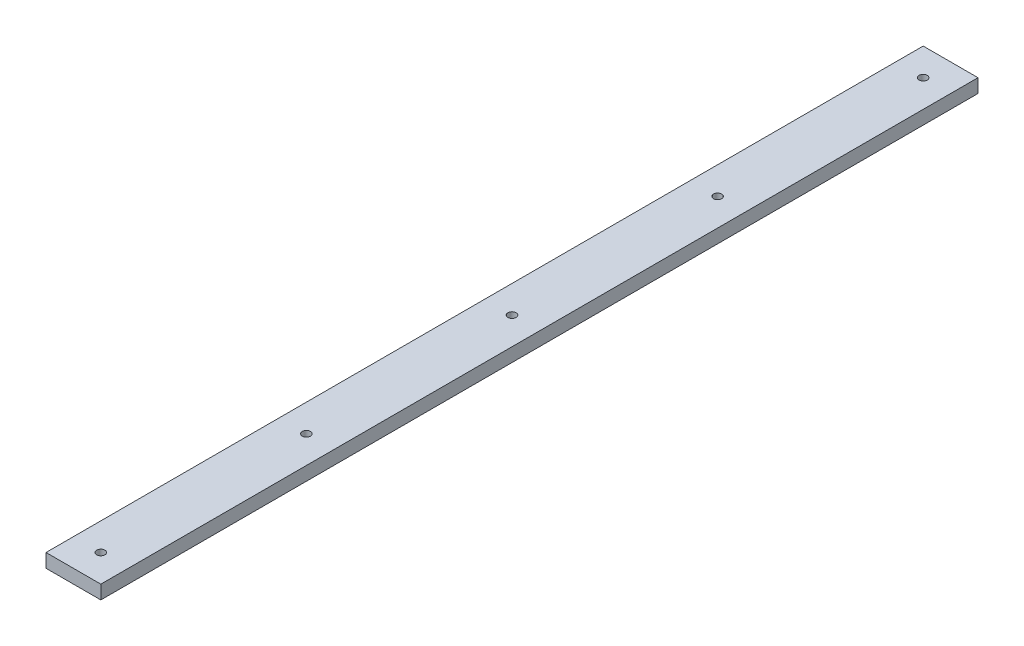
from build123d import *

# Parameters (mm, degrees)
SKETCH_1_W             = 40
SKETCH_1_H             = 640
EXTRUDE_1_DEPTH        = 5
SKETCH_2_R             = 3
CUT_EXTRUDE_1_DEPTH    = 321.780298647
PATTERN_LINEAR_1_COUNT = 5
PATTERN_LINEAR_1_PITCH = 150


with BuildPart() as part:
    # Эскиз1 → Бобышка-Вытянуть1 (new, symmetric)
    with BuildSketch(Plane(origin=(0, 0, 0), x_dir=(1, 0, 0), z_dir=(0, 1, 0))):
        Rectangle(SKETCH_1_W, SKETCH_1_H)
    extrude(amount=EXTRUDE_1_DEPTH, both=True)

    # Эскиз2 → Вырез-Вытянуть1 (cut, through all)
    with BuildSketch(Plane(origin=(0, 5, 0), x_dir=(1, 0, 0), z_dir=(0, 1, 0))):
        with Locations((0, -300)):
            Circle(SKETCH_2_R)
    cut_extrude_1 = extrude(amount=-CUT_EXTRUDE_1_DEPTH, mode=Mode.SUBTRACT)

    # Линейный массив1: Вырез-Вытянуть1 ×5
    with Locations(*[(0, 0, -i * PATTERN_LINEAR_1_PITCH) for i in range(1, PATTERN_LINEAR_1_COUNT)]):
        add(cut_extrude_1, mode=Mode.SUBTRACT)


solid = part.part
